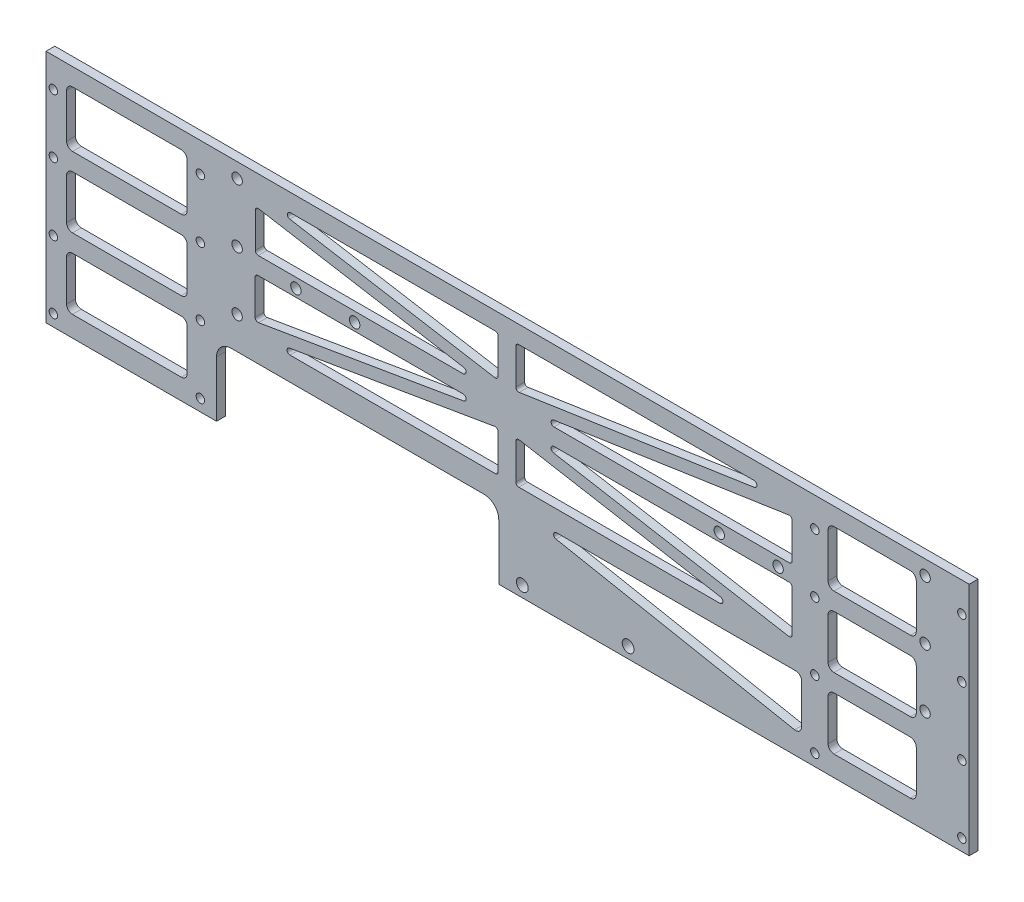
from build123d import *

# Parameters (mm, degrees)
SKETCH1_W                  = 398.78
SKETCH1_H                  = 101.6
BOSS_EXTRUDE1_DEPTH        = 3.81
SKETCH11_W                 = 121.92
SKETCH11_H                 = 30.48
CUT_EXTRUDE1_DEPTH         = 206.794869227
F_6_CLEARANCE_HOLE1_D      = 3.6576
F_8_CLEARANCE_HOLE1_D      = 4.4958
FILLET1_R                  = 6.35
F_7_0_201_DIAMETER_HOLE1_D = 5.1054
CUT_EXTRUDE2_DEPTH         = 206.794869227


with BuildPart() as part:
    # Sketch1 → Boss-Extrude1 (new body)
    with BuildSketch(Plane.XY):
        Rectangle(SKETCH1_W, SKETCH1_H)
    extrude(amount=BOSS_EXTRUDE1_DEPTH)

    # Sketch11 → Cut-Extrude1 (cut, through all)
    with BuildSketch(Plane.XY.offset(3.81)):
        with Locations((-64.77, -35.56)):
            Rectangle(SKETCH11_W, SKETCH11_H)
    extrude(amount=-CUT_EXTRUDE1_DEPTH, mode=Mode.SUBTRACT)

    # #6 Clearance Hole1 (through all)
    with Locations(Plane.XY.offset(3.81)):
        with Locations((132.715, -45.72), (196.215, -45.72), (132.715, 12.7), (132.715, -16.51), (196.215, 38.1), (196.215, -16.51), (-196.215, 38.1), (-196.215, 12.7), (-196.215, -16.51), (-196.215, -45.72), (-132.715, 38.1), (-132.715, 12.7), (-132.715, -16.51), (-132.715, -45.72), (196.215, 12.7), (132.715, 38.1)):
            Hole(F_6_CLEARANCE_HOLE1_D / 2)

    # #8 Clearance Hole1 (through all)
    with Locations(Plane.XY.offset(3.81)):
        with Locations((180.34, 44.45), (180.34, 19.05), (180.34, -6.35), (-116.84, 44.45), (-116.84, 19.05), (-116.84, -6.35), (91.44, 16.064768226), (116.84, 16.064768226), (-91.44, 16.064768226), (-66.04, 16.064768226)):
            Hole(F_8_CLEARANCE_HOLE1_D / 2)

    # Fillet1
    fillet1_edges = [part.edges().sort_by_distance(p)[0] for p in [
        (-125.73, -20.32, 1.905),
        (-3.81, -20.32, 1.905),
    ]]
    fillet(fillet1_edges, radius=FILLET1_R)

    # #7 (0.201) Diameter Hole1 (through all)
    with Locations(Plane.XY.offset(3.81)):
        with Locations((6.35, -46.0375), (52.07, -46.0375)):
            Hole(F_7_0_201_DIAMETER_HOLE1_D / 2)

    # Sketch28 → Cut-Extrude2 (cut, through all)
    with BuildSketch(Plane.XY.offset(3.81)):
        with BuildLine():
            Line((-187.96, 43.18), (-140.97, 43.18))
            ThreePointArc((-140.97, 43.18), (-139.173948776, 42.436051224), (-138.43, 40.64))
            Line((-138.43, 40.64), (-138.43, 21.59))
            ThreePointArc((-138.43, 21.59), (-139.173948776, 19.793948776), (-140.97, 19.05))
            Line((-140.97, 19.05), (-187.96, 19.05))
            ThreePointArc((-187.96, 19.05), (-189.756051224, 19.793948776), (-190.5, 21.59))
            Line((-190.5, 21.59), (-190.5, 40.64))
            ThreePointArc((-190.5, 40.64), (-189.756051224, 42.436051224), (-187.96, 43.18))
        make_face()
        with BuildLine():
            Line((-187.96, 11.43), (-140.97, 11.43))
            ThreePointArc((-140.97, 11.43), (-139.173948776, 10.686051224), (-138.43, 8.89))
            Line((-138.43, 8.89), (-138.43, -8.89))
            ThreePointArc((-138.43, -8.89), (-139.173948776, -10.686051224), (-140.97, -11.43))
            Line((-140.97, -11.43), (-187.96, -11.43))
            ThreePointArc((-187.96, -11.43), (-189.756051224, -10.686051224), (-190.5, -8.89))
            Line((-190.5, -8.89), (-190.5, 8.89))
            ThreePointArc((-190.5, 8.89), (-189.756051224, 10.686051224), (-187.96, 11.43))
        make_face()
        with BuildLine():
            Line((-187.96, -19.05), (-140.97, -19.05))
            ThreePointArc((-140.97, -19.05), (-139.173948776, -19.793948776), (-138.43, -21.59))
            Line((-138.43, -21.59), (-138.43, -39.37))
            ThreePointArc((-138.43, -39.37), (-139.173948776, -41.166051224), (-140.97, -41.91))
            Line((-140.97, -41.91), (-187.96, -41.91))
            ThreePointArc((-187.96, -41.91), (-189.756051224, -41.166051224), (-190.5, -39.37))
            Line((-190.5, -39.37), (-190.5, -21.59))
            ThreePointArc((-190.5, -21.59), (-189.756051224, -19.793948776), (-187.96, -19.05))
        make_face()
        with BuildLine():
            Line((140.97, 43.18), (173.99, 43.18))
            ThreePointArc((173.99, 43.18), (175.786051224, 42.436051224), (176.53, 40.64))
            Line((176.53, 40.64), (176.53, 21.59))
            ThreePointArc((176.53, 21.59), (175.786051224, 19.793948776), (173.99, 19.05))
            Line((173.99, 19.05), (140.97, 19.05))
            ThreePointArc((140.97, 19.05), (139.173948776, 19.793948776), (138.43, 21.59))
            Line((138.43, 21.59), (138.43, 40.64))
            ThreePointArc((138.43, 40.64), (139.173948776, 42.436051224), (140.97, 43.18))
        make_face()
        with BuildLine():
            Line((140.97, 11.43), (173.99, 11.43))
            ThreePointArc((173.99, 11.43), (175.786051224, 10.686051224), (176.53, 8.89))
            Line((176.53, 8.89), (176.53, -8.89))
            ThreePointArc((176.53, -8.89), (175.786051224, -10.686051224), (173.99, -11.43))
            Line((173.99, -11.43), (140.97, -11.43))
            ThreePointArc((140.97, -11.43), (139.173948776, -10.686051224), (138.43, -8.89))
            Line((138.43, -8.89), (138.43, 8.89))
            ThreePointArc((138.43, 8.89), (139.173948776, 10.686051224), (140.97, 11.43))
        make_face()
        with BuildLine():
            Line((140.97, -19.05), (173.99, -19.05))
            ThreePointArc((173.99, -19.05), (175.786051224, -19.793948776), (176.53, -21.59))
            Line((176.53, -21.59), (176.53, -39.37))
            ThreePointArc((176.53, -39.37), (175.786051224, -41.166051224), (173.99, -41.91))
            Line((173.99, -41.91), (140.97, -41.91))
            ThreePointArc((140.97, -41.91), (139.173948776, -41.166051224), (138.43, -39.37))
            Line((138.43, -39.37), (138.43, -21.59))
            ThreePointArc((138.43, -21.59), (139.173948776, -19.793948776), (140.97, -19.05))
        make_face()
        with BuildLine():
            Line((127, -21.59), (127, -38.836704925))
            ThreePointArc((127, -38.836704925), (126.078129822, -40.794575166), (123.981688283, -41.331262581))
            Line((123.981688283, -41.331262581), (20.905816914, -21.567278828))
            ThreePointArc((20.905816914, -21.567278828), (19.880665826, -20.199883623), (21.144972773, -19.05))
            Line((21.144972773, -19.05), (124.46, -19.05))
            ThreePointArc((124.46, -19.05), (126.256051224, -19.793948776), (127, -21.59))
        make_face()
        with BuildLine():
            Line((-107.492331216, 37.776324117), (-18.953196281, 22.769691077))
            ThreePointArc((-18.953196281, 22.769691077), (-17.899896116, 21.411060376), (-19.165423733, 20.247549109))
            Line((-19.165423733, 20.247549109), (-107.704558669, 20.247549109))
            ThreePointArc((-107.704558669, 20.247549109), (-108.602584281, 20.619523497), (-108.974558669, 21.517549109))
            Line((-108.974558669, 21.517549109), (-108.974558669, 36.524182149))
            ThreePointArc((-108.974558669, 36.524182149), (-108.524122923, 37.494344214), (-107.492331216, 37.776324117))
        make_face()
        with BuildLine():
            Line((-4.072558669, 41.91), (-4.072558669, 26.90336696))
            ThreePointArc((-4.072558669, 26.90336696), (-4.522994414, 25.933204895), (-5.554786121, 25.651224992))
            Line((-5.554786121, 25.651224992), (-94.093921056, 40.657858032))
            ThreePointArc((-94.093921056, 40.657858032), (-95.147221221, 42.016488733), (-93.881693604, 43.18))
            Line((-93.881693604, 43.18), (-5.342558669, 43.18))
            ThreePointArc((-5.342558669, 43.18), (-4.444533056, 42.808025612), (-4.072558669, 41.91))
        make_face()
        with BuildLine():
            Line((-5.342558669, -10.16), (-93.988558669, -10.16))
            ThreePointArc((-93.988558669, -10.16), (-95.254096681, -8.996365115), (-94.200541497, -7.637816595))
            Line((-94.200541497, -7.637816595), (-5.554541497, 7.369114299))
            ThreePointArc((-5.554541497, 7.369114299), (-4.522899652, 7.087012898), (-4.072558669, 6.116930893))
            Line((-4.072558669, 6.116930893), (-4.072558669, -8.89))
            ThreePointArc((-4.072558669, -8.89), (-4.444533056, -9.788025612), (-5.342558669, -10.16))
        make_face()
        with BuildLine():
            Line((-109.099088824, 11.43), (-109.099088824, -3.576930893))
            ThreePointArc((-109.099088824, -3.576930893), (-108.648747841, -4.547012898), (-107.617105995, -4.829114299))
            Line((-107.617105995, -4.829114299), (-18.971105995, 10.177816595))
            ThreePointArc((-18.971105995, 10.177816595), (-17.917550811, 11.536365115), (-19.183088824, 12.7))
            Line((-19.183088824, 12.7), (-107.829088824, 12.7))
            ThreePointArc((-107.829088824, 12.7), (-108.727114436, 12.328025612), (-109.099088824, 11.43))
        make_face()
        with BuildLine():
            Line((121.657441331, 19.968630261), (20.057441331, 19.968630261))
            ThreePointArc((20.057441331, 19.968630261), (18.790965313, 21.144086648), (19.868878783, 22.494553892))
            Line((19.868878783, 22.494553892), (121.468878783, 37.748630261))
            ThreePointArc((121.468878783, 37.748630261), (122.486122682, 37.455092842), (122.927441331, 36.492706631))
            Line((122.927441331, 36.492706631), (122.927441331, 21.238630261))
            ThreePointArc((122.927441331, 21.238630261), (122.555466944, 20.340604649), (121.657441331, 19.968630261))
        make_face()
        with BuildLine():
            Line((3.547441331, 41.91), (3.547441331, 26.65592363))
            ThreePointArc((3.547441331, 26.65592363), (3.988759981, 25.69353742), (5.00600388, 25.4))
            Line((5.00600388, 25.4), (106.60600388, 40.65407637))
            ThreePointArc((106.60600388, 40.65407637), (107.68391735, 42.004543613), (106.417441331, 43.18))
            Line((106.417441331, 43.18), (4.817441331, 43.18))
            ThreePointArc((4.817441331, 43.18), (3.919415719, 42.808025612), (3.547441331, 41.91))
        make_face()
        with BuildLine():
            Line((5.037055861, 7.62), (91.949122619, -7.639132518))
            ThreePointArc((91.949122619, -7.639132518), (92.994715919, -9.000223177), (91.729508089, -10.16))
            Line((91.729508089, -10.16), (4.817441331, -10.16))
            ThreePointArc((4.817441331, -10.16), (3.919415719, -9.788025612), (3.547441331, -8.89))
            Line((3.547441331, -8.89), (3.547441331, 6.369132518))
            ThreePointArc((3.547441331, 6.369132518), (4.000743852, 7.341709109), (5.037055861, 7.62))
        make_face()
        with BuildLine():
            Line((122.927441331, 11.43), (122.927441331, -6.407889739))
            ThreePointArc((122.927441331, -6.407889739), (122.474138811, -7.38046633), (121.437826802, -7.658757221))
            Line((121.437826802, -7.658757221), (19.837826802, 10.179132518))
            ThreePointArc((19.837826802, 10.179132518), (18.792233502, 11.540223177), (20.057441331, 12.7))
            Line((20.057441331, 12.7), (121.657441331, 12.7))
            ThreePointArc((121.657441331, 12.7), (122.555466944, 12.328025612), (122.927441331, 11.43))
        make_face()
    extrude(amount=-CUT_EXTRUDE2_DEPTH, mode=Mode.SUBTRACT)


solid = part.part
